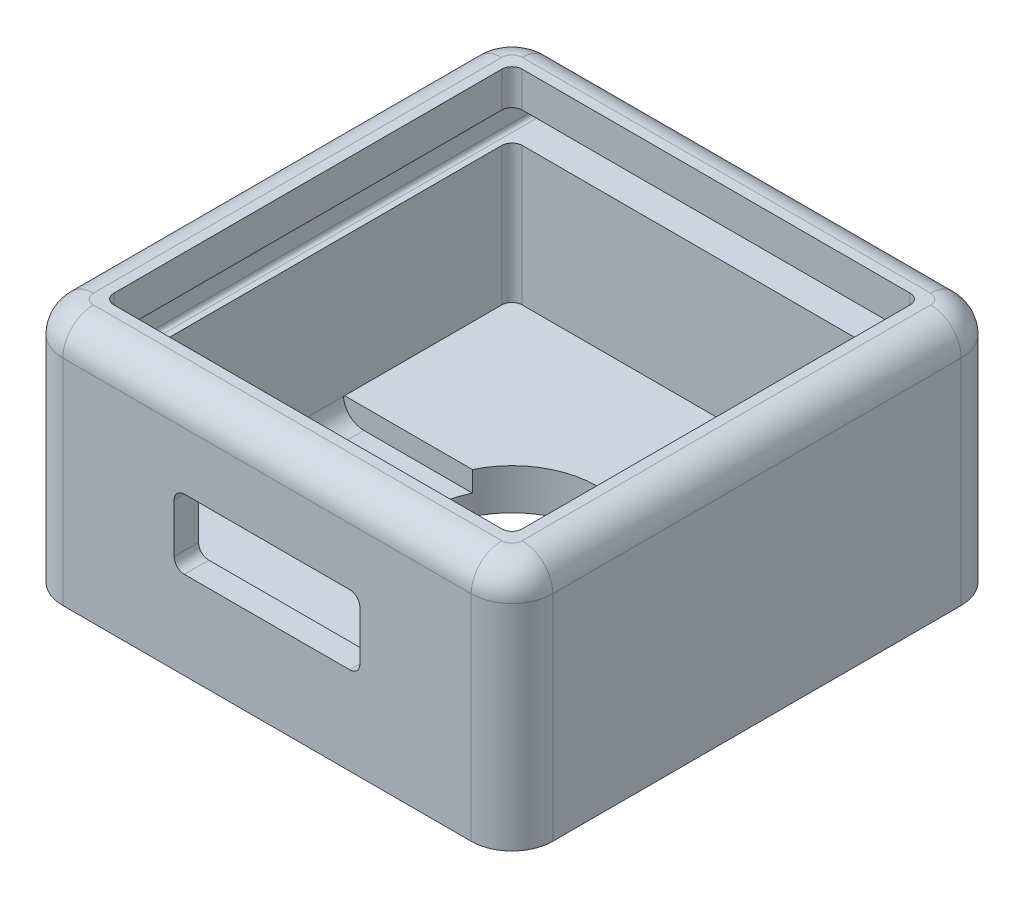
from build123d import *

# Parameters (mm, degrees)
BOSS_EXTRUDE2_DEPTH = 2
BOSS_EXTRUDE3_DEPTH = 10
CUT_EXTRUDE1_REACH  = 31.394
CUT_EXTRUDE2_REACH  = 21.698
SKETCH5_R           = 4.15
SKETCH6_W           = 20
SKETCH6_H           = 3.6
CUT_EXTRUDE3_DEPTH  = 1
FILLET1_R           = 1
CUT_EXTRUDE4_START  = -0.8
CUT_EXTRUDE4_DEPTH  = 0.8
SKETCH8_W           = 13.4
SKETCH8_H           = 1.173218526
BOSS_EXTRUDE4_DEPTH = 1.3
SKETCH10_W          = 0.69
SKETCH10_H          = 1.173218526
BOSS_EXTRUDE5_DEPTH = 2
FILLET2_R           = 0.5
FILLET6_R           = 0.5
FILLET8_R           = 1.5
CUT_EXTRUDE6_DEPTH  = 22.5
FILLET9_R           = 0.2


with BuildPart() as part:
    # Sketch2 → Boss-Extrude2 (new body)
    with BuildSketch(Plane(origin=(0, 0, 0), x_dir=(1, 0, 0), z_dir=(0, 1, 0))):
        with BuildLine():
            Line((-10, -12), (10, -12))
            ThreePointArc((10, -12), (11.414213562, -11.414213562), (12, -10))
            Line((12, -10), (12, 10))
            ThreePointArc((12, 10), (11.414213562, 11.414213562), (10, 12))
            Line((10, 12), (-10, 12))
            ThreePointArc((-10, 12), (-11.414213562, 11.414213562), (-12, 10))
            Line((-12, 10), (-12, -10))
            ThreePointArc((-12, -10), (-11.414213562, -11.414213562), (-10, -12))
        make_face()
    extrude(amount=BOSS_EXTRUDE2_DEPTH)

    # Sketch3 → Boss-Extrude3 (add)
    with BuildSketch(Plane(origin=(0, 2, 0), x_dir=(1, 0, 0), z_dir=(0, 1, 0))):
        with BuildLine():
            Line((-10, -12), (10, -12))
            ThreePointArc((10, -12), (11.414213562, -11.414213562), (12, -10))
            Line((12, -10), (12, 10))
            ThreePointArc((12, 10), (11.414213562, 11.414213562), (10, 12))
            Line((10, 12), (-10, 12))
            ThreePointArc((-10, 12), (-11.414213562, 11.414213562), (-12, 10))
            Line((-12, 10), (-12, -10))
            ThreePointArc((-12, -10), (-11.414213562, -11.414213562), (-10, -12))
        make_face()
        with BuildLine():
            Line((-9.5, -10), (9.5, -10))
            ThreePointArc((9.5, -10), (9.853553391, -9.853553391), (10, -9.5))
            Line((10, -9.5), (10, 9.5))
            ThreePointArc((10, 9.5), (9.853553391, 9.853553391), (9.5, 10))
            Line((9.5, 10), (-9.5, 10))
            ThreePointArc((-9.5, 10), (-9.853553391, 9.853553391), (-10, 9.5))
            Line((-10, 9.5), (-10, -9.5))
            ThreePointArc((-10, -9.5), (-9.853553391, -9.853553391), (-9.5, -10))
        make_face(mode=Mode.SUBTRACT)
    extrude(amount=BOSS_EXTRUDE3_DEPTH)

    # Sketch4 → Cut-Extrude1 (cut, up to next)
    with BuildSketch(Plane.XY.offset(12), mode=Mode.PRIVATE) as cut_extrude1_sk1:
        with BuildLine():
            Line((-4.05, 7.7), (4.05, 7.7))
            ThreePointArc((4.05, 7.7), (4.403553391, 7.553553391), (4.55, 7.2))
            Line((4.55, 7.2), (4.55, 4.8))
            ThreePointArc((4.55, 4.8), (4.403553391, 4.446446609), (4.05, 4.3))
            Line((4.05, 4.3), (-4.05, 4.3))
            ThreePointArc((-4.05, 4.3), (-4.403553391, 4.446446609), (-4.55, 4.8))
            Line((-4.55, 4.8), (-4.55, 7.2))
            ThreePointArc((-4.55, 7.2), (-4.403553391, 7.553553391), (-4.05, 7.7))
        make_face()
    cut_extrude1_tool1 = extrude(cut_extrude1_sk1.sketch, amount=-CUT_EXTRUDE1_REACH, mode=Mode.PRIVATE) & part.part
    add(cut_extrude1_tool1.solids().sort_by_distance((0, 6, 12))[0], mode=Mode.SUBTRACT)

    # Sketch5 → Cut-Extrude2 (cut, up to next)
    with BuildSketch(Plane(origin=(0, 2, 0), x_dir=(1, 0, 0), z_dir=(0, 1, 0)), mode=Mode.PRIVATE) as cut_extrude2_sk1:
        with Locations(Location((0, 0, 0), (0, 0, 270))):
            Circle(SKETCH5_R)
    cut_extrude2_tool1 = extrude(cut_extrude2_sk1.sketch, amount=-CUT_EXTRUDE2_REACH, mode=Mode.PRIVATE) & part.part
    add(cut_extrude2_tool1.solids().sort_by_distance((0, 2, 0))[0], mode=Mode.SUBTRACT)

    # Sketch6 → Cut-Extrude3 (cut)
    with BuildSketch(Plane(origin=(0, 2, 0), x_dir=(1, 0, 0), z_dir=(0, 1, 0))):
        with Locations((-0.054263112, 0)):
            Rectangle(SKETCH6_W, SKETCH6_H)
    extrude(amount=-CUT_EXTRUDE3_DEPTH, mode=Mode.SUBTRACT)

    # Fillet1
    fillet1_edges = [part.edges().sort_by_distance(p)[0] for p in [
        (9.945736888, 1, 0),
        (-10.054263112, 1, 0),
    ]]
    fillet(fillet1_edges, radius=FILLET1_R - 0.0001)  # a hair under: the kernel refuses the full size

    # Sketch7 → Cut-Extrude4 (cut)
    with BuildSketch(Plane(origin=(0, 0, 10), x_dir=(-1, 0, 0), z_dir=(0, 0, -1)).offset(CUT_EXTRUDE4_START)):
        with BuildLine():
            Line((-6.05, 8.26), (-6.05, 4.3))
            Line((-6.05, 4.3), (-4.05, 4.3))
            ThreePointArc((-4.05, 4.3), (-4.403553391, 4.446446609), (-4.55, 4.8))
            Line((-4.55, 4.8), (-4.55, 7.2))
            ThreePointArc((-4.55, 7.2), (-4.403553391, 7.553553391), (-4.05, 7.7))
            Line((-4.05, 7.7), (4.05, 7.7))
            ThreePointArc((4.05, 7.7), (4.403553391, 7.553553391), (4.55, 7.2))
            Line((4.55, 7.2), (4.55, 4.8))
            ThreePointArc((4.55, 4.8), (4.403553391, 4.446446609), (4.05, 4.3))
            Line((4.05, 4.3), (6.05, 4.3))
            Line((6.05, 4.3), (6.05, 8.26))
            Line((6.05, 8.26), (-6.05, 8.26))
        make_face()
        Polygon((-6.05, 4.3), (-6.05, 3.3), (6.05, 3.3), (6.05, 4.3), (4.05, 4.3), (-4.05, 4.3), align=None)
    extrude(amount=CUT_EXTRUDE4_DEPTH, mode=Mode.SUBTRACT)

    # Sketch8 → Boss-Extrude4 (add)
    with BuildSketch(Plane(origin=(0, 2, 0), x_dir=(1, 0, 0), z_dir=(0, 1, 0))):
        with Locations((0, -4.736609263)):
            Rectangle(SKETCH8_W, SKETCH8_H)
    extrude(amount=BOSS_EXTRUDE4_DEPTH)

    # Sketch10 → Boss-Extrude5 (add)
    with BuildSketch(Plane(origin=(0, 3.3, 0), x_dir=(1, 0, 0), z_dir=(0, 1, 0))):
        with Locations((6.355, -4.736609263)):
            Rectangle(SKETCH10_W, SKETCH10_H)
        with Locations((-6.355, -4.736609263)):
            Rectangle(SKETCH10_W, SKETCH10_H)
    extrude(amount=BOSS_EXTRUDE5_DEPTH)

    # Fillet2
    fillet2_edges = [part.edges().sort_by_distance(p)[0] for p in [
        (-6.01, 3.3, 4.736609263),
        (6.01, 3.3, 4.736609263),
    ]]
    fillet(fillet2_edges, radius=FILLET2_R)

    # Fillet6
    fillet6_edges = [part.edges().sort_by_distance(p)[0] for p in [
        (6.7, 2, 4.736609263),
        (-6.7, 2, 4.736609263),
    ]]
    fillet(fillet6_edges, radius=FILLET6_R)

    # Fillet8
    fillet8_edges = [part.edges().sort_by_distance(p)[0] for p in [
        (-12, 12, 0),
        (-11.414213562, 12, 11.414213562),
        (11.414213562, 12, -11.414213562),
        (0, 12, -12),
        (-11.414213562, 12, -11.414213562),
        (0, 12, 12),
        (11.414213562, 12, 11.414213562),
        (12, 12, 0),
    ]]
    fillet(fillet8_edges, radius=FILLET8_R)

    # Sketch21 → Cut-Extrude6 (cut)
    with BuildSketch(Plane(origin=(0, 0, -12), x_dir=(-1, 0, 0), z_dir=(0, 0, -1))):
        with BuildLine():
            Line((-10.3, 10.26661549), (10.3, 10.26661549))
            ThreePointArc((10.3, 10.26661549), (10.441421356, 10.208036847), (10.5, 10.06661549))
            Line((10.5, 10.06661549), (10.5, 8.96661549))
            ThreePointArc((10.5, 8.96661549), (10.441421356, 8.825194134), (10.3, 8.76661549))
            Line((10.3, 8.76661549), (-10.3, 8.76661549))
            ThreePointArc((-10.3, 8.76661549), (-10.441421356, 8.825194134), (-10.5, 8.96661549))
            Line((-10.5, 8.96661549), (-10.5, 10.06661549))
            ThreePointArc((-10.5, 10.06661549), (-10.441421356, 10.208036847), (-10.3, 10.26661549))
        make_face()
    extrude(amount=-CUT_EXTRUDE6_DEPTH, mode=Mode.SUBTRACT)

    # Fillet9
    fillet9_edges = [part.edges().sort_by_distance(p)[0] for p in [
        (10.441421356, 8.825194134, 10.5),
        (10.5, 9.51661549, 10.5),
        (10.441421356, 10.208036847, 10.5),
        (-10.441421356, 8.825194134, 10.5),
        (-10.441421356, 10.208036847, 10.5),
        (-10.5, 9.51661549, 10.5),
        (0, 8.76661549, 10.5),
        (0, 10.26661549, 10.5),
    ]]
    fillet(fillet9_edges, radius=FILLET9_R)


solid = part.part
